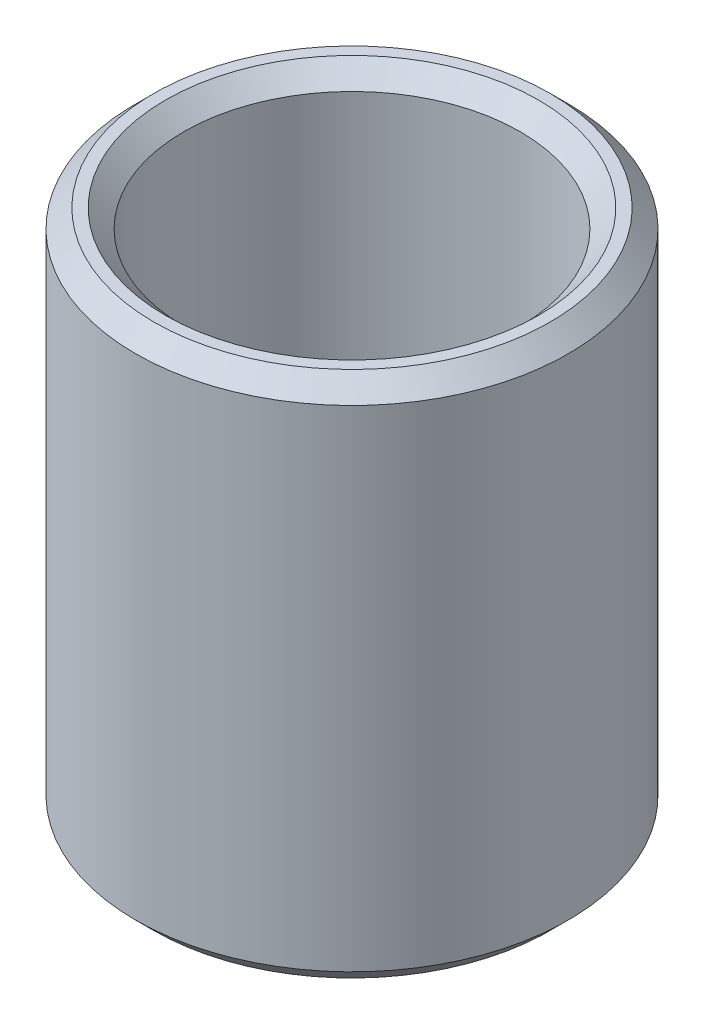
from build123d import *

# Parameters (mm, degrees)
SKETCH1_R           = 42.5
BOSS_EXTRUDE1_DEPTH = 103.510891805
SKETCH2_R           = 33.045831815
CUT_EXTRUDE1_DEPTH  = 120.695466591
CHAMFER1_SIZE       = 3.591361717


with BuildPart() as part:
    # Sketch1 → Boss-Extrude1 (new body)
    with BuildSketch(Plane(origin=(0, 0, 0), x_dir=(1, 0, 0), z_dir=(0, 1, 0))):
        Circle(SKETCH1_R)
    extrude(amount=BOSS_EXTRUDE1_DEPTH)

    # Sketch2 → Cut-Extrude1 (cut, through all)
    with BuildSketch(Plane(origin=(0, 0, 0), x_dir=(1, 0, 0), z_dir=(0, 1, 0))):
        Circle(SKETCH2_R)
    extrude(amount=CUT_EXTRUDE1_DEPTH, mode=Mode.SUBTRACT)

    # Chamfer1
    chamfer1_edges = [part.edges().sort_by_distance(p)[0] for p in [
        (-33.045831815, 103.510891805, 0),
        (-33.045831815, 0, 0),
        (-42.5, 0, 0),
        (-42.5, 103.510891805, 0),
    ]]
    chamfer(chamfer1_edges, length=CHAMFER1_SIZE)


solid = part.part
